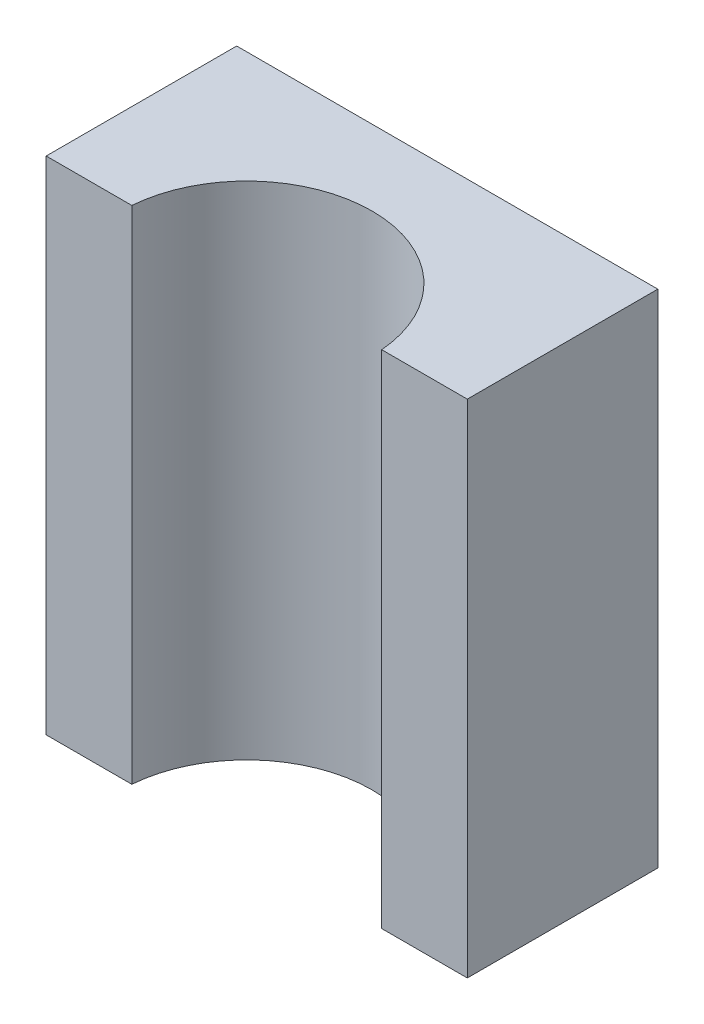
from build123d import *

# Parameters (mm, degrees)
DODANIE_WYCI_GNI_CIE1_DEPTH = 25


with BuildPart() as part:
    # Szkic1 → Dodanie-wyciągnięcie1 (new, symmetric)
    with BuildSketch(Plane(origin=(0, 0, 0), x_dir=(1, 0, 0), z_dir=(0, 1, 0))):
        with BuildLine():
            Line((21, -9.5), (12.459935794, -9.5))
            ThreePointArc((12.459935794, -9.5), (0, 2), (-12.459935794, -9.5))
            Line((-12.459935794, -9.5), (-21, -9.5))
            Line((-21, -9.5), (-21, 9.5))
            Line((-21, 9.5), (21, 9.5))
            Line((21, 9.5), (21, -9.5))
        make_face()
    extrude(amount=DODANIE_WYCI_GNI_CIE1_DEPTH, both=True)


solid = part.part
